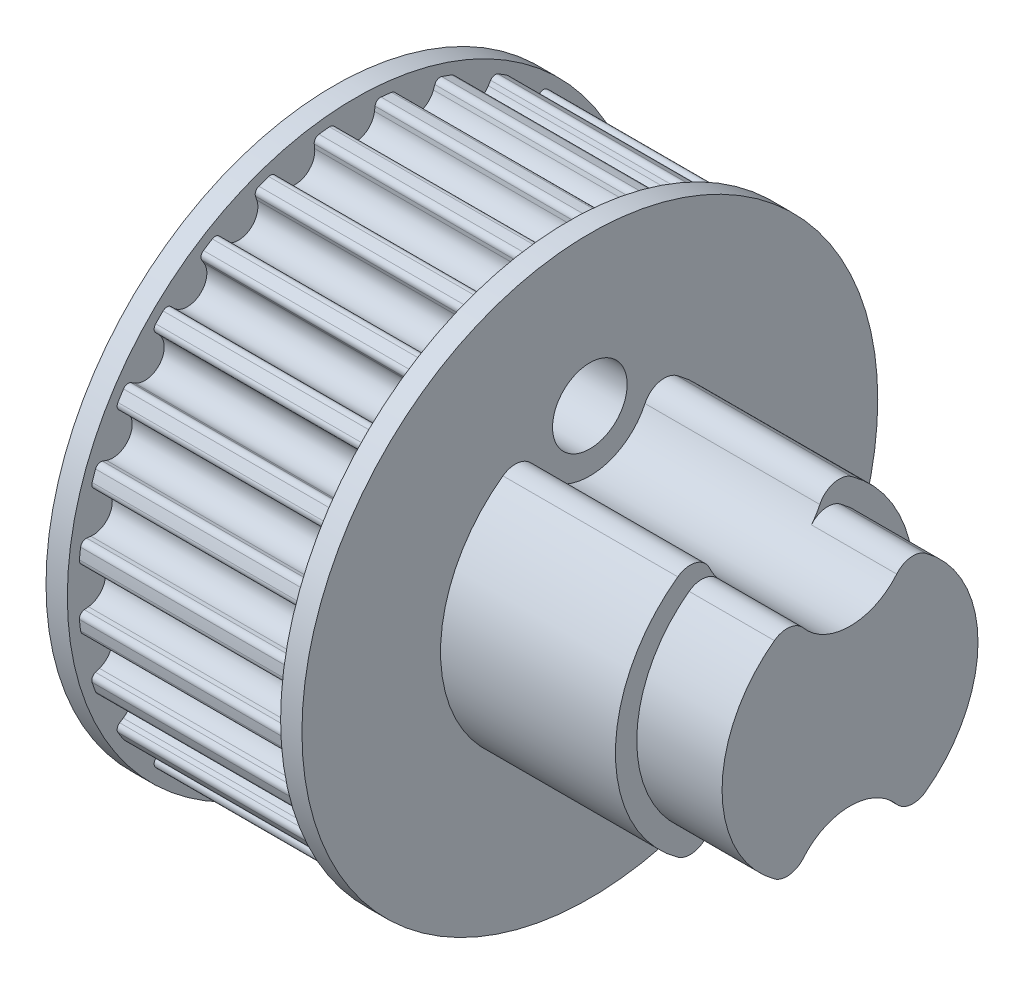
from build123d import *

# Parameters (mm, degrees)
CUT_EXTRUDE_2_REACH      = 23.309
PATTERN_CIRCULAR_3_COUNT = 28
SKETCH_7_R               = 2.5978
EXTRUDE_1_DEPTH          = 10.8
SKETCH_8_R               = 13.5
EXTRUDE_2_DEPTH          = 1
EXTRUDE_START            = 1
SKETCH_9_R               = 13.5
EXTRUDE_3_DEPTH          = 1
SKETCH_10_R              = 9.5
CUT_EXTRUDE_3_DEPTH      = 5
SKETCH_11_R              = 1.75
SKETCH_11_R_2            = 1.6
CUT_EXTRUDE_4_DEPTH      = 13
SKETCH_12_R              = 7
EXTRUDE_4_DEPTH          = 8.2
SKETCH_13_R              = 6
EXTRUDE_5_DEPTH          = 4
CUT_EXTRUDE_START        = -12.2
SKETCH_14_R              = 2.85
CUT_EXTRUDE_5_DEPTH      = 12.2
FILLET_2_R               = 1
FILLET_3_R               = 1


with BuildPart() as part:
    # 草图1 → 旋转1 (revolve)
    with BuildSketch(Plane.XY, mode=Mode.PRIVATE) as revolve_1_sk:
        Polygon((0, 2.5978), (0, 12.989), (10, 12.989), (10, 5.1956), (10.8, 5.1956), (10.8, 2.5978), align=None)
    revolve(revolve_1_sk.sketch.rotate(Axis((0, 0, 0), (1, 0, 0)), 90), axis=Axis((0, 0, 0), (1, 0, 0)))

    # 草图6 → 切除-拉伸2 (cut, up to next)
    with BuildSketch(Plane(origin=(0, 0, 0), x_dir=(0, 0, -1), z_dir=(1, 0, 0)), mode=Mode.PRIVATE) as cut_extrude_2_sk1:
        with BuildLine():
            Line((0.92743771, 12.70536077), (0.903216998, 12.508098898))
            ThreePointArc((0.903216998, 12.508098898), (0, 11.709), (-0.903216998, 12.508098898))
            Line((-0.903216998, 12.508098898), (-0.92743771, 12.70536077))
            ThreePointArc((-0.92743771, 12.70536077), (-1.022483568, 12.876222852), (-1.209714489, 12.932544678))
            ThreePointArc((-1.209714489, 12.932544678), (-1.339088868, 12.91978955), (-1.468329108, 12.90574022))
            Line((-1.468329108, 12.90574022), (-1.664977096, 14.507309562))
            ThreePointArc((-1.664977096, 14.507309562), (0, 14.602540172), (1.664977096, 14.507309562))
            Line((1.664977096, 14.507309562), (1.468329108, 12.90574022))
            ThreePointArc((1.468329108, 12.90574022), (1.339088868, 12.91978955), (1.209714489, 12.932544678))
            ThreePointArc((1.209714489, 12.932544678), (1.022483568, 12.876222852), (0.92743771, 12.70536077))
        make_face()
    cut_extrude_2_tool1 = extrude(cut_extrude_2_sk1.sketch, amount=CUT_EXTRUDE_2_REACH, mode=Mode.PRIVATE) & part.part
    cut_extrude_2 = cut_extrude_2_tool1.solids().sort_by_distance((0, 13.400539, 0))[0]
    add(cut_extrude_2, mode=Mode.SUBTRACT)

    # 阵列(圆周)3: 切除-拉伸2 ×28 about axis
    pattern_circular_3_axis = Axis((0, 0, 0), (1, 0, 0))
    for i in range(1, PATTERN_CIRCULAR_3_COUNT):
        add(cut_extrude_2.rotate(pattern_circular_3_axis, i * 360 / PATTERN_CIRCULAR_3_COUNT), mode=Mode.SUBTRACT)

    # 草图7 → 凸台-拉伸1 (add)
    with BuildSketch(Plane.ZY):
        Circle(SKETCH_7_R)
    extrude(amount=-EXTRUDE_1_DEPTH)

    # 草图8 → 凸台-拉伸2 (add)
    with BuildSketch(Plane.ZY):
        Circle(SKETCH_8_R)
    extrude(amount=EXTRUDE_2_DEPTH)

    # 草图9 → 凸台-拉伸3 (add)
    with BuildSketch(Plane(origin=(10, 0, 0), x_dir=(0, 0, -1), z_dir=(1, 0, 0)).offset(EXTRUDE_START)):
        with Locations(Location((0, 0, 0), (0, 0, 180))):
            Circle(SKETCH_9_R)
    extrude(amount=-EXTRUDE_3_DEPTH)

    # 草图10 → 切除-拉伸3 (cut)
    with BuildSketch(Plane.ZY.offset(1)):
        Circle(SKETCH_10_R)
    extrude(amount=-CUT_EXTRUDE_3_DEPTH, mode=Mode.SUBTRACT)

    # 草图11 → 切除-拉伸4 (cut)
    with BuildSketch(Plane.ZY.offset(-4)):
        with Locations((0, 6.5)):
            Circle(SKETCH_11_R)
        with Locations((0, -6.5)):
            Circle(SKETCH_11_R_2)
    extrude(amount=-CUT_EXTRUDE_4_DEPTH, mode=Mode.SUBTRACT)

    # 草图12 → 凸台-拉伸4 (add)
    with BuildSketch(Plane(origin=(11, 0, 0), x_dir=(0, 0, -1), z_dir=(1, 0, 0))):
        with Locations(Location((0, 0, 0), (0, 0, 104.281970741))):
            Circle(SKETCH_12_R)
    extrude(amount=EXTRUDE_4_DEPTH)

    # 草图13 → 凸台-拉伸5 (add)
    with BuildSketch(Plane(origin=(19.2, 0, 0), x_dir=(0, 0, -1), z_dir=(1, 0, 0))):
        Circle(SKETCH_13_R)
    extrude(amount=EXTRUDE_5_DEPTH)

    # 草图14 → 切除-拉伸5 (cut)
    with BuildSketch(Plane(origin=(23.2, 0, 0), x_dir=(0, 0, -1), z_dir=(1, 0, 0)).offset(CUT_EXTRUDE_START)):
        with Locations((0, 6.5)):
            Circle(SKETCH_14_R)
        with Locations((0, -6.5)):
            Circle(SKETCH_14_R)
    extrude(amount=CUT_EXTRUDE_5_DEPTH, mode=Mode.SUBTRACT)

    # 圆角2
    fillet_2_edges = [part.edges().sort_by_distance(p)[0] for p in [
        (15.1, 6.394423077, 2.848043805),
        (15.1, 6.394423077, -2.848043805),
        (15.1, -6.394423077, -2.848043805),
        (15.1, -6.394423077, 2.848043805),
    ]]
    fillet(fillet_2_edges, radius=FILLET_2_R)

    # 圆角3
    # the kernel refuses this fillet: 1 mm, written as the material it takes off along each edge
    with BuildSketch(Plane(origin=(25.868048979, -5.391271555, -2.633285214), x_dir=(0, 0.8496685026519665, 0.5273172058648998), z_dir=(-1, 0, 0)), Plane(origin=(19.2, -5.391271555, 2.633285214), x_dir=(0, 0.8496685026519674, -0.5273172058648985), z_dir=(1, 0, 0)), Plane(origin=(25.868048979, 5.391271555, 2.633285214), x_dir=(0, -0.849668502651966, -0.5273172058649006), z_dir=(-1, 0, 0))) as fillet_3_piece_1:
        with BuildLine():
            CenterArc((0.984192351, 0.990200382), FILLET_3_R, 175.58719098, 86.38499151)
            Line((-0.012843225, 1.067142309), (-0.112546783, 1.074836502))
            ThreePointArc((-0.112546783, 1.074836502), (-0.13018804, 0.532081606), (-0.099489504, -0.010091512))
            Line((-0.099489504, -0.010091512), (0.001765619, -0.099984412))
            ThreePointArc((0.001765619, -0.099984412), (0.114966993, -0.092131656), (0.830573097, -0.099020038))
            Line((0.830573097, -0.099020038), (0.844538484, 0))
        make_face()
    extrude(amount=6.668048979, mode=Mode.SUBTRACT)
    with BuildSketch(Plane(origin=(25.868048979, 5.391271555, -2.633285214), x_dir=(0, -0.8496685026519658, 0.5273172058649009), z_dir=(-1, 0, 0))) as fillet_3_piece_2:
        with BuildLine():
            CenterArc((0.984192351, -0.990200382), FILLET_3_R, 98.027817511, 86.38499151)
            Line((-0.012843225, -1.067142309), (-0.112546783, -1.074836502))
            ThreePointArc((-0.112546783, -1.074836502), (-0.13018804, -0.532081606), (-0.099489504, 0.010091512))
            Line((-0.099489504, 0.010091512), (0.001765619, 0.099984412))
            ThreePointArc((0.001765619, 0.099984412), (0.114966993, 0.092131656), (0.830573097, 0.099020038))
            Line((0.830573097, 0.099020038), (0.844538484, 0))
        make_face()
    extrude(amount=6.668048979, mode=Mode.SUBTRACT)


solid = part.part
